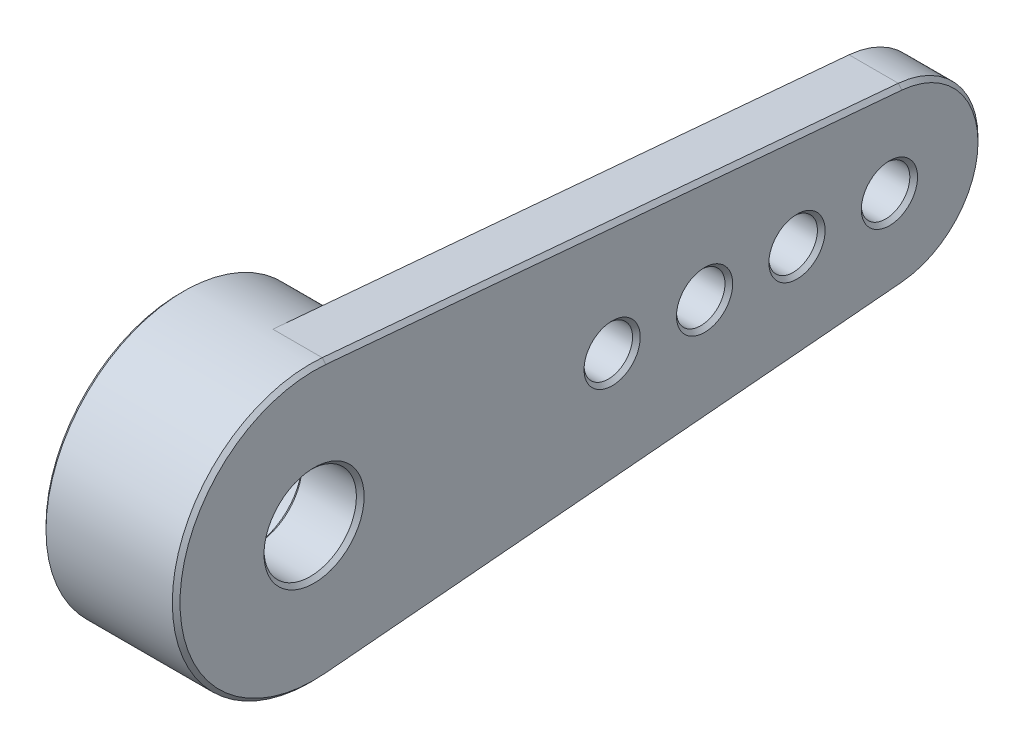
from build123d import *

# Parameters (mm, degrees)
BOSS_EXTRUDE1_DEPTH = 2.9972
CUT_EXTRUDE1_DEPTH  = 1.524
SKETCH6_R           = 1.1176
CUT_EXTRUDE3_DEPTH  = 29.630171982
CUT_EXTRUDE4_DEPTH  = 7.62
BOSS_EXTRUDE2_START = 0.4064
SKETCH9_R           = 1.1176
BOSS_EXTRUDE2_DEPTH = 0.4064
SKETCH10_R          = 1.1176
SKETCH10_R_2        = 0.8001
BOSS_EXTRUDE3_DEPTH = 1.8796
SKETCH11_R          = 4.5466
BOSS_EXTRUDE4_DEPTH = 2.54
SKETCH12_R          = 2.8702
CUT_EXTRUDE5_DEPTH  = 2.3749
SKETCH13_R          = 1.524
CUT_EXTRUDE6_DEPTH  = 28.807597626
SKETCH14_R          = 0.8001
CUT_EXTRUDE7_DEPTH  = 29.056286281
CHAMFER1_SIZE       = 0.127
CHAMFER2_SIZE       = 0.127
CHAMFER3_SIZE       = 0.127
SCALE1_SCALE        = 0.6


with BuildPart() as part:
    # Sketch1 → Boss-Extrude1 (new body)
    with BuildSketch(Plane(origin=(0, 0, 0), x_dir=(0, 0, -1), z_dir=(1, 0, 0))):
        with BuildLine():
            Line((24.769539012, 3.626266444), (5.771274976, 5.288399174))
            ThreePointArc((5.771274976, 5.288399174), (0, 0), (5.771274976, -5.288399174))
            Line((5.771274976, -5.288399174), (24.769539012, -3.626266444))
            ThreePointArc((24.769539012, -3.626266444), (28.0924, 0), (24.769539012, 3.626266444))
        make_face()
    extrude(amount=BOSS_EXTRUDE1_DEPTH)

    # Sketch4 → Cut-Extrude1 (cut)
    with BuildSketch(Plane(origin=(2.9972, 0, 0), x_dir=(0, 0, -1), z_dir=(1, 0, 0))):
        with BuildLine():
            Line((24.703126336, 2.867166085), (5.7048623, 4.529298814))
            ThreePointArc((5.7048623, 4.529298814), (0.762, 0), (5.7048623, -4.529298814))
            Line((5.7048623, -4.529298814), (24.703126336, -2.867166085))
            ThreePointArc((24.703126336, -2.867166085), (27.3304, 0), (24.703126336, 2.867166085))
        make_face()
    extrude(amount=-CUT_EXTRUDE1_DEPTH, mode=Mode.SUBTRACT)

    # Sketch6 → Cut-Extrude3 (cut, through all)
    with BuildSketch(Plane(origin=(1.4732, 0, 0), x_dir=(0, 0, -1), z_dir=(1, 0, 0))):
        with Locations((21.2344, 0)):
            Circle(SKETCH6_R)
    extrude(amount=-CUT_EXTRUDE3_DEPTH, mode=Mode.SUBTRACT)

    # Sketch7 → Cut-Extrude4 (cut)
    with BuildSketch(Plane(origin=(2.9972, 0, 0), x_dir=(0, 0, -1), z_dir=(1, 0, 0))):
        with BuildLine():
            Line((5.771274976, -5.288399174), (24.769539012, -3.626266444))
            ThreePointArc((24.769539012, -3.626266444), (28.0924, 0), (24.769539012, 3.626266444))
            Line((24.769539012, 3.626266444), (5.771274976, 5.288399174))
            ThreePointArc((5.771274976, 5.288399174), (0, 0), (5.771274976, -5.288399174))
        make_face()
        with BuildLine():
            Line((24.703126336, 2.867166085), (5.7048623, 4.529298814))
            ThreePointArc((5.7048623, 4.529298814), (0.762, 0), (5.7048623, -4.529298814))
            Line((5.7048623, -4.529298814), (24.703126336, -2.867166085))
            ThreePointArc((24.703126336, -2.867166085), (27.3304, 0), (24.703126336, 2.867166085))
        make_face(mode=Mode.SUBTRACT)
    extrude(amount=-CUT_EXTRUDE4_DEPTH, mode=Mode.SUBTRACT)

    # Sketch9 → Boss-Extrude2 (add)
    with BuildSketch(Plane(origin=(1.4732, 0, 0), x_dir=(0, 0, -1), z_dir=(1, 0, 0)).offset(BOSS_EXTRUDE2_START)):
        with BuildLine():
            Line((24.703126336, 2.867166085), (5.7048623, 4.529298814))
            ThreePointArc((5.7048623, 4.529298814), (0.762, 0), (5.7048623, -4.529298814))
            Line((5.7048623, -4.529298814), (24.703126336, -2.867166085))
            ThreePointArc((24.703126336, -2.867166085), (27.3304, 0), (24.703126336, 2.867166085))
        make_face()
        with Locations((21.2344, 0)):
            Circle(SKETCH9_R, mode=Mode.SUBTRACT)
    extrude(amount=-BOSS_EXTRUDE2_DEPTH)

    # Sketch10 → Boss-Extrude3 (add)
    with BuildSketch(Plane(origin=(1.8796, 0, 0), x_dir=(0, 0, -1), z_dir=(1, 0, 0))):
        with Locations((21.2344, 0)):
            Circle(SKETCH10_R)
        with Locations((21.2344, 0)):
            Circle(SKETCH10_R_2, mode=Mode.SUBTRACT)
    extrude(amount=-BOSS_EXTRUDE3_DEPTH)

    # Sketch11 → Boss-Extrude4 (add)
    with BuildSketch(Plane.ZY):
        with Locations(Location((-5.3086, 0, 0), (0, 0, 95))):
            Circle(SKETCH11_R)
    extrude(amount=BOSS_EXTRUDE4_DEPTH)

    # Sketch12 → Cut-Extrude5 (cut)
    with BuildSketch(Plane.ZY.offset(2.54)):
        with Locations((-5.3086, 0)):
            Circle(SKETCH12_R)
    extrude(amount=-CUT_EXTRUDE5_DEPTH, mode=Mode.SUBTRACT)

    # Sketch13 → Cut-Extrude6 (cut, through all)
    with BuildSketch(Plane.ZY.offset(0.1651)):
        with Locations((-5.3086, 0)):
            Circle(SKETCH13_R)
    extrude(amount=-CUT_EXTRUDE6_DEPTH, mode=Mode.SUBTRACT)

    # Sketch14 → Cut-Extrude7 (cut, through all)
    with BuildSketch(Plane(origin=(1.8796, 0, 0), x_dir=(0, 0, -1), z_dir=(1, 0, 0))):
        with Locations((18.1864, 0)):
            Circle(SKETCH14_R)
        with Locations((15.1384, 0)):
            Circle(SKETCH14_R)
        with Locations((24.2824, 0)):
            Circle(SKETCH14_R)
    extrude(amount=-CUT_EXTRUDE7_DEPTH, mode=Mode.SUBTRACT)

    # Chamfer1
    chamfer1_edges = [part.edges().sort_by_distance(p)[0] for p in [
        (-2.54, -4.529298814, -4.9123377),
        (-2.54, 0, -8.1788),
        (1.8796, 0, -6.8326),
        (-0.1651, 0, -6.8326),
    ]]
    chamfer(chamfer1_edges, length=CHAMFER1_SIZE)

    # Chamfer2
    chamfer2_edges = [part.edges().sort_by_distance(p)[0] for p in [
        (0, 0, -17.3863),
        (1.8796, 0, -17.3863),
        (0, 0, -14.3383),
        (1.8796, 0, -14.3383),
        (0, 0, -23.4823),
        (1.8796, 0, -23.4823),
        (1.8796, 0, -27.3304),
        (1.8796, 3.698232449, -15.203994318),
        (1.8796, 0, -0.762),
        (1.8796, -3.698232449, -15.203994318),
        (0, 0, -20.4343),
        (1.8796, 0, -20.4343),
    ]]
    chamfer(chamfer2_edges, length=CHAMFER2_SIZE)

    # Chamfer3
    # the kernel refuses this chamfer: 0.127 mm, written as the material it takes off along each edge
    with BuildSketch(Plane(origin=(0, -4.557764206, -5.379501386), x_dir=(0.9996219169112968, -0.027391246498850615, -0.002396423548493402), z_dir=(0, 0.08715574274765155, -0.9961946980917461))) as chamfer3_piece_1_section:
        Polygon((CHAMFER3_SIZE * 0.999621916911, -CHAMFER3_SIZE * 0.0274958766106), (-CHAMFER3_SIZE * 0.0274958766106, -CHAMFER3_SIZE * 0.999621916911), (0, 0), align=None)
    chamfer3_piece_1 = extrude(amount=19.397438057, mode=Mode.PRIVATE)
    chamfer3_piece_1 = chamfer3_piece_1 - Plane(origin=(0.042171089, 0, -5.3086), x_dir=(0, 0.9961946980917455, -0.08715574274765824), z_dir=(1, 0, 0)) * Cylinder(4.5466, 40, mode=Mode.PRIVATE)
    add(chamfer3_piece_1, mode=Mode.SUBTRACT)
    with BuildSketch(Plane(origin=(0, 2.867166085, -24.703126336), x_dir=(-0.027495876610586393, -0.9958180537233419, 0.08712279063523509), z_dir=(0, 0.08715574274765134, 0.9961946980917462))) as chamfer3_piece_2_section:
        Polygon((CHAMFER3_SIZE * 0.999621916911, CHAMFER3_SIZE * 0.0274958766106), (-CHAMFER3_SIZE * 0.0274958766106, CHAMFER3_SIZE * 0.999621916911), (0, 0), align=None)
    chamfer3_piece_2 = extrude(amount=19.397438057, mode=Mode.PRIVATE)
    chamfer3_piece_2 = chamfer3_piece_2 - Plane(origin=(0.042171094, 0, -5.3086), x_dir=(0, 0.9961946980917455, -0.08715574274765824), z_dir=(1, 0, 0)) * Cylinder(4.5466, 40, mode=Mode.PRIVATE)
    add(chamfer3_piece_2, mode=Mode.SUBTRACT)
    with BuildSketch(Plane(origin=(0, 0, -24.452281807), x_dir=(0, -0.996194698091746, -0.08715574274765267), z_dir=(0, -0.08715574274765267, 0.996194698091746))) as chamfer3_piece_3:
        Polygon((2.878118193 - CHAMFER3_SIZE, 0), (2.878118193, CHAMFER3_SIZE), (2.878118193, 0), align=None)
    revolve(axis=Axis((0, 0, -24.452281807), (1, 0, 0)), revolution_arc=170, mode=Mode.SUBTRACT)


with BuildPart() as part_1:
    # Scale1: scaled about (0.419801812, 0, -11.241664116)
    add(part.part.scale(SCALE1_SCALE).moved(Location((0.167920725, 0, -4.496665646))))


solid = part_1.part
